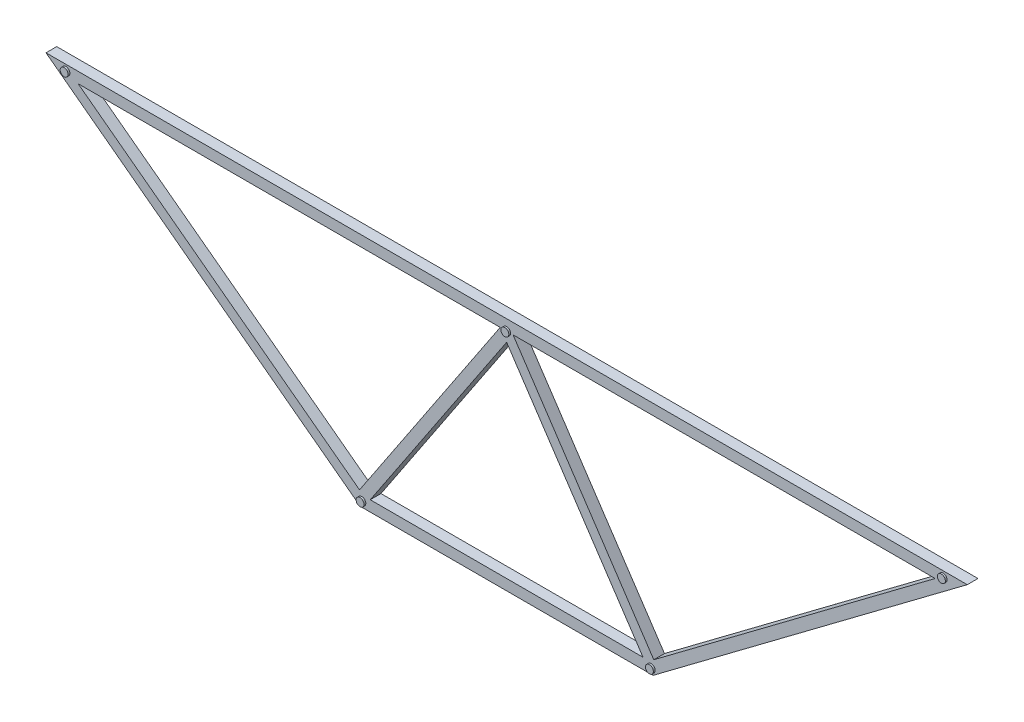
from build123d import *

# Parameters (mm, degrees)
TRUSS_BODY_DEPTH            = 15
SKETCH25_R                  = 5.555
PIN_HOLES_DEPTH             = 1285.318885635
BOSS_EXTRUDE10_DEPTH        = 2.5
BOSS_EXTRUDE10_DEPTH_BACK   = 17.5
SKETCH29_R                  = 5.555
BOSS_EXTRUDE10_2_DEPTH      = 2.5
BOSS_EXTRUDE10_2_DEPTH_BACK = 17.5
BOSS_EXTRUDE10_3_DEPTH      = 2.5
BOSS_EXTRUDE10_3_DEPTH_BACK = 17.5
BOSS_EXTRUDE10_4_DEPTH      = 2.5
BOSS_EXTRUDE10_4_DEPTH_BACK = 17.5
BOSS_EXTRUDE10_5_DEPTH      = 2.5
BOSS_EXTRUDE10_5_DEPTH_BACK = 17.5


with BuildPart() as part:
    # Sketch22 → Truss Body (new body)
    with BuildSketch(Plane.XY):
        Polygon((-45, 15), (395, -315), (805, -315), (1245, 15), align=None)
        Polygon((806.009252126, -295.493060906), (609.013878189, 0), (1200, 0), align=None, mode=Mode.SUBTRACT)
        Polygon((600, -13.520817283), (790.986121811, -300), (409.013878189, -300), align=None, mode=Mode.SUBTRACT)
        Polygon((590.986121811, 0), (393.990747874, -295.493060906), (0, 0), align=None, mode=Mode.SUBTRACT)
    extrude(amount=TRUSS_BODY_DEPTH)

    # Sketch25 → Pin Holes (cut, through all)
    with BuildSketch(Plane.XY.offset(15)):
        with Locations((-17.115239435, 6.712760082)):
            Circle(SKETCH25_R)
        with Locations((397.256799451, -307.553177602)):
            Circle(SKETCH25_R)
        with Locations((802.394900329, -307.553177602)):
            Circle(SKETCH25_R)
        with Locations((1211.207349081, 6.712760082)):
            Circle(SKETCH25_R)
        with Locations((600, 0)):
            Circle(SKETCH25_R)
    extrude(amount=-PIN_HOLES_DEPTH, mode=Mode.SUBTRACT)


with BuildPart() as body_2:
    # Sketch29 → Boss-Extrude10 (new, two sides: drawn at the far end of the back side and taken through both)
    with BuildSketch(Plane.XY.offset(15).offset(-BOSS_EXTRUDE10_DEPTH_BACK)):
        with Locations((-17.115239435, 6.712760082)):
            Circle(SKETCH29_R)
    extrude(amount=BOSS_EXTRUDE10_DEPTH + BOSS_EXTRUDE10_DEPTH_BACK)


with BuildPart() as body_3:
    # Sketch29 → Boss-Extrude10 2 (new, two sides: drawn at the far end of the back side and taken through both)
    with BuildSketch(Plane.XY.offset(15).offset(-BOSS_EXTRUDE10_2_DEPTH_BACK)):
        with Locations((397.256799451, -307.553177602)):
            Circle(SKETCH29_R)
    extrude(amount=BOSS_EXTRUDE10_2_DEPTH + BOSS_EXTRUDE10_2_DEPTH_BACK)


with BuildPart() as body_4:
    # Sketch29 → Boss-Extrude10 3 (new, two sides: drawn at the far end of the back side and taken through both)
    with BuildSketch(Plane.XY.offset(15).offset(-BOSS_EXTRUDE10_3_DEPTH_BACK)):
        with Locations((802.394900329, -307.553177602)):
            Circle(SKETCH29_R)
    extrude(amount=BOSS_EXTRUDE10_3_DEPTH + BOSS_EXTRUDE10_3_DEPTH_BACK)


with BuildPart() as body_5:
    # Sketch29 → Boss-Extrude10 4 (new, two sides: drawn at the far end of the back side and taken through both)
    with BuildSketch(Plane.XY.offset(15).offset(-BOSS_EXTRUDE10_4_DEPTH_BACK)):
        with Locations((1211.207349081, 6.712760082)):
            Circle(SKETCH29_R)
    extrude(amount=BOSS_EXTRUDE10_4_DEPTH + BOSS_EXTRUDE10_4_DEPTH_BACK)


with BuildPart() as body_6:
    # Sketch29 → Boss-Extrude10 5 (new, two sides: drawn at the far end of the back side and taken through both)
    with BuildSketch(Plane.XY.offset(15).offset(-BOSS_EXTRUDE10_5_DEPTH_BACK)):
        with Locations((600, 0)):
            Circle(SKETCH29_R)
    extrude(amount=BOSS_EXTRUDE10_5_DEPTH + BOSS_EXTRUDE10_5_DEPTH_BACK)


solid = Compound([part.part, body_2.part, body_3.part, body_4.part, body_5.part, body_6.part])
